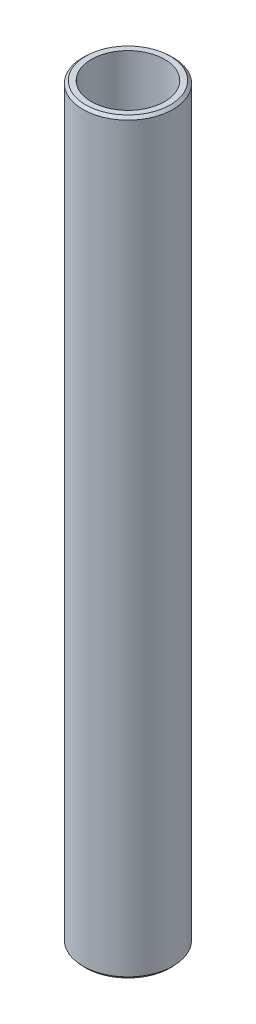
from build123d import *
from OCP.BRepFilletAPI import BRepFilletAPI_MakeChamfer

# Parameters (mm, degrees)
SKETCH1_R           = 22.5
BOSS_EXTRUDE1_DEPTH = 373.312115991
SKETCH2_R           = 18.312497118
CUT_EXTRUDE1_DEPTH  = 375.665765645
CHAMFER1_SIZE       = 1.267068991
CHAMFER1_SIZE2      = 1.392997991


with BuildPart() as part:
    # Sketch1 → Boss-Extrude1 (new body)
    with BuildSketch(Plane(origin=(0, 0, 0), x_dir=(1, 0, 0), z_dir=(0, 1, 0))):
        Circle(SKETCH1_R)
    extrude(amount=BOSS_EXTRUDE1_DEPTH)

    # Sketch2 → Cut-Extrude1 (cut, through all)
    with BuildSketch(Plane(origin=(0, 0, 0), x_dir=(1, 0, 0), z_dir=(0, 1, 0))):
        Circle(SKETCH2_R)
    extrude(amount=CUT_EXTRUDE1_DEPTH, mode=Mode.SUBTRACT)

    # Chamfer1: one chamfer whose edges measure the first distance from different faces: ONE call of the kernel's chamfer builder (chamfer() names one face for all edges)
    chamfer1_edges_1 = [part.edges().sort_by_distance(p)[0] for p in [
        (-22.5, 373.312115991, 0),
    ]]
    chamfer1_side_1 = [part.faces().sort_by_distance(p)[0] for p in [
        (-22.5, 186.656057996, 0),
    ]]
    chamfer1_edges_2 = [part.edges().sort_by_distance(p)[0] for p in [
        (-22.5, 0, 0),
    ]]
    chamfer1_side_2 = [part.faces().sort_by_distance(p)[0] for p in [
        (-21.863603897, 0, 0),
    ]]
    chamfer1 = BRepFilletAPI_MakeChamfer(part.part.solid().wrapped)
    for e in chamfer1_edges_1:
        chamfer1.Add(CHAMFER1_SIZE, CHAMFER1_SIZE2, e.wrapped, chamfer1_side_1[0].wrapped)  # the first distance lies on this face
    for e in chamfer1_edges_2:
        chamfer1.Add(CHAMFER1_SIZE, CHAMFER1_SIZE2, e.wrapped, chamfer1_side_2[0].wrapped)  # the first distance lies on this face
    add(Compound.cast(chamfer1.Shape()), mode=Mode.REPLACE)


solid = part.part
